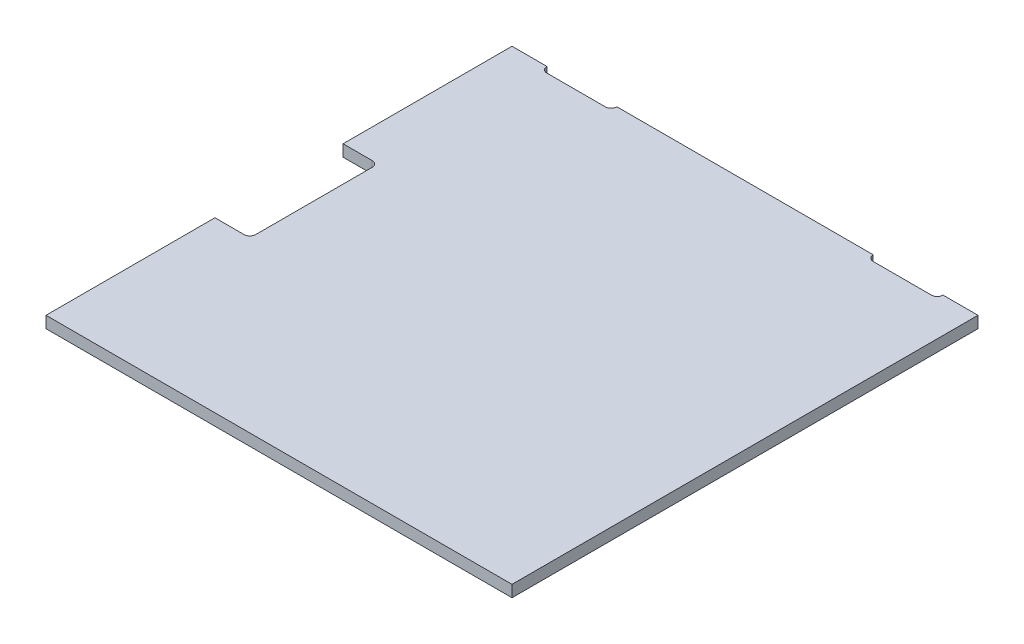
from build123d import *

# Parameters (mm, degrees)
EXTRUDE_1_DEPTH     = 2
SKETCH_2_W          = 12
SKETCH_2_H          = 1
CUT_EXTRUDE_1_DEPTH = 2
FILLET_1_R          = 1
FILLET_2_R          = 1


with BuildPart() as part:
    # 草图1 → 凸台-拉伸1 (new body)
    with BuildSketch(Plane(origin=(0, 0, 0), x_dir=(1, 0, 0), z_dir=(0, 1, 0))):
        Polygon((-40, 11), (-40, 40), (40, 40), (40, -40), (-40, -40), (-40, -11), (-34, -11), (-34, 11), align=None)
    extrude(amount=EXTRUDE_1_DEPTH)

    # 草图2 → 切除-拉伸1 (cut)
    with BuildSketch(Plane(origin=(0, 2, 0), x_dir=(1, 0, 0), z_dir=(0, 1, 0))):
        with Locations((-28, 39.5)):
            Rectangle(SKETCH_2_W, SKETCH_2_H)
        with Locations((28, 39.5)):
            Rectangle(SKETCH_2_W, SKETCH_2_H)
    extrude(amount=-CUT_EXTRUDE_1_DEPTH, mode=Mode.SUBTRACT)

    # 圆角1
    fillet_1_edges = [part.edges().sort_by_distance(p)[0] for p in [
        (22, 1, -39),
        (34, 1, -39),
        (-34, 1, -39),
        (-22, 1, -39),
    ]]
    fillet(fillet_1_edges, radius=FILLET_1_R - 0.0001)  # a hair under: the kernel refuses the full size

    # 圆角2
    fillet_2_edges = [part.edges().sort_by_distance(p)[0] for p in [
        (-34, 1, 11),
        (-34, 1, -11),
    ]]
    fillet(fillet_2_edges, radius=FILLET_2_R)


solid = part.part
